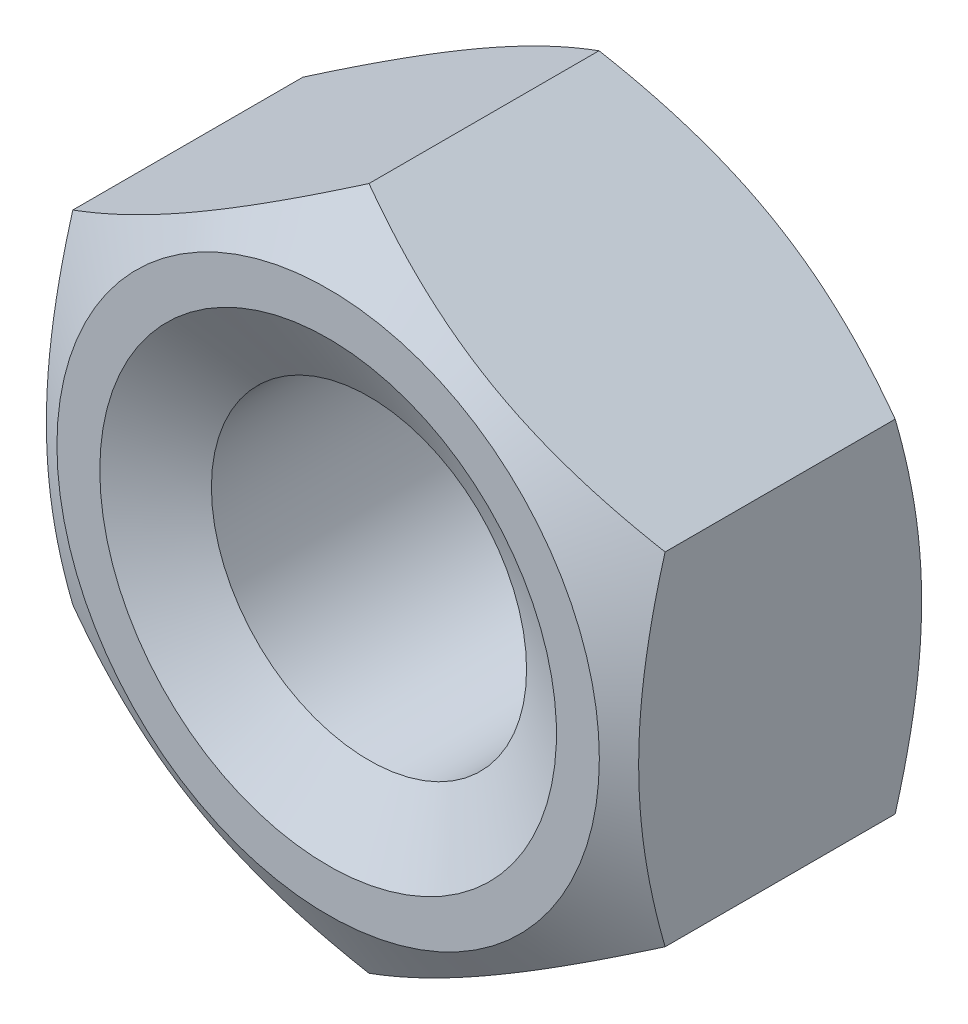
from build123d import *

# Parameters (mm, degrees)
SKETCH_1_R        = 5.055
EXTRUDE_780_DEPTH = 10


with BuildPart() as part:
    # Эскиз1 → Extrude 780 (new body)
    with BuildSketch(Plane.XY):
        Polygon((0, 10.969655115), (-9.5, 5.484827557), (-9.5, -5.484827557), (0, -10.969655115), (9.5, -5.484827557), (9.5, 5.484827557), align=None)
        Circle(SKETCH_1_R, mode=Mode.SUBTRACT)
    extrude(amount=EXTRUDE_780_DEPTH)

    # Эскиз2 → Вырез-Повернуть1 (revolve, cut)
    with BuildSketch(Plane(origin=(0, 0, 0), x_dir=(0, 0, -1), z_dir=(1, 0, 0))):
        Polygon((-10, 8.7), (-10, 10.969655115), (-8.689614009, 10.969655115), align=None)
        Polygon((-8.689614009, 5.055), (-10, 5.055), (-10, 7.324655115), align=None)
        Polygon((0, 7.324655115), (0, 5.055), (-1.310385991, 5.055), align=None)
        Polygon((0, 8.7), (-1.310385991, 10.969655115), (0, 10.969655115), align=None)
    revolve(axis=Axis((0, 0, 0), (0, 0, 1)), mode=Mode.SUBTRACT)


with BuildPart() as body_2:
    # Эскиз2<3> → Revolve 1099 (revolve)
    with BuildSketch(Plane(origin=(0, 0, 0), x_dir=(0, 0, -1), z_dir=(1, 0, 0))):
        Polygon((0, 5.055), (0, 7.324655115), (-1.310385991, 5.055), align=None)
    revolve(axis=Axis((0, 0, 0), (0, 0, 1)))


solid = Compound([part.part, body_2.part])
